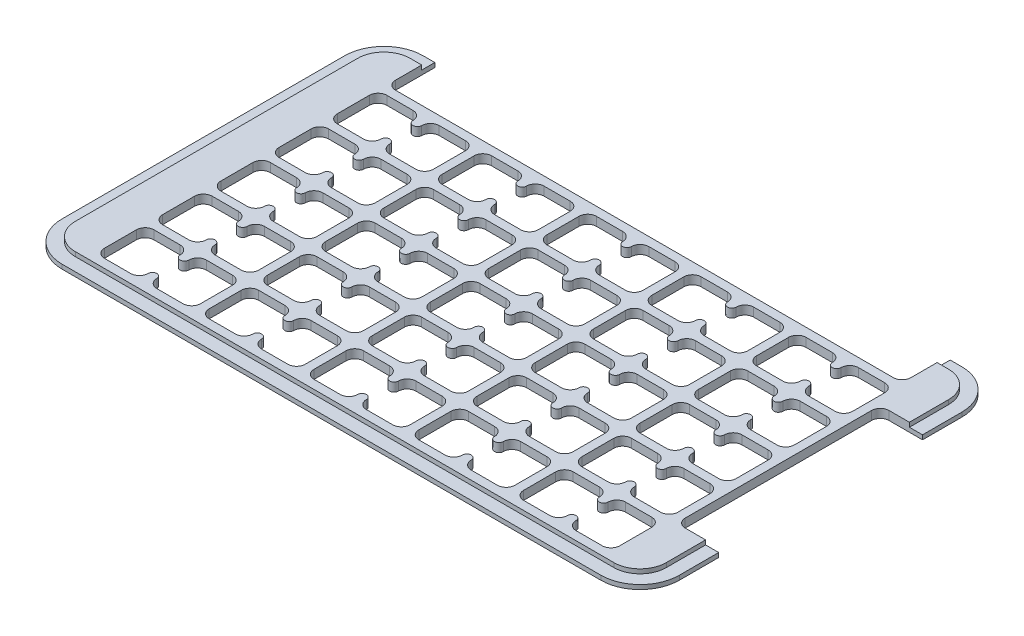
from build123d import *

# Parameters (mm, degrees)
SKETCH1_W                    = 212
SKETCH1_H                    = 124
OUTER_PROFILE_DEPTH          = 1.5
SKETCH2_W                    = 203
SKETCH2_H                    = 115
INNER_PROFILE_DEPTH          = 1.5
FILLET1_R                    = 9
FILLET2_R                    = 13.5
SKETCH4_W                    = 177
SKETCH4_H                    = 16.5
SKETCH4_W_2                  = 14.5
SKETCH4_H_2                  = 70
MESSAGE_BAR_DEPTH            = 123.837290755
CUTOUT_DEPTH                 = 123.837290755
CUTOUTS_COUNT                = 5
CUTOUTS_PITCH                = 18
CUTOUTS_COUNT_DIR2           = 5
CUTOUTS_PITCH_DIR2           = 20
MIRROR_CUTOUTS_COPY_1_DEPTH  = 123.837290755
MIRROR_CUTOUTS_COPY_2_DEPTH  = 123.837290755
MIRROR_CUTOUTS_COPY_3_DEPTH  = 123.837290755
MIRROR_CUTOUTS_COPY_4_DEPTH  = 123.837290755
MIRROR_CUTOUTS_COPY_5_DEPTH  = 123.837290755
MIRROR_CUTOUTS_COPY_6_DEPTH  = 123.837290755
MIRROR_CUTOUTS_COPY_7_DEPTH  = 123.837290755
MIRROR_CUTOUTS_COPY_8_DEPTH  = 123.837290755
MIRROR_CUTOUTS_COPY_9_DEPTH  = 123.837290755
MIRROR_CUTOUTS_COPY_10_DEPTH = 123.837290755
MIRROR_CUTOUTS_COPY_11_DEPTH = 123.837290755
MIRROR_CUTOUTS_COPY_12_DEPTH = 123.837290755
MIRROR_CUTOUTS_COPY_13_DEPTH = 123.837290755
MIRROR_CUTOUTS_COPY_14_DEPTH = 123.837290755
MIRROR_CUTOUTS_COPY_15_DEPTH = 123.837290755
MIRROR_CUTOUTS_COPY_16_DEPTH = 123.837290755
MIRROR_CUTOUTS_COPY_17_DEPTH = 123.837290755
MIRROR_CUTOUTS_COPY_18_DEPTH = 123.837290755
MIRROR_CUTOUTS_COPY_19_DEPTH = 123.837290755
MIRROR_CUTOUTS_COPY_20_DEPTH = 123.837290755
MIRROR_CUTOUTS_COPY_21_DEPTH = 123.837290755
MIRROR_CUTOUTS_COPY_22_DEPTH = 123.837290755
MIRROR_CUTOUTS_COPY_23_DEPTH = 123.837290755
MIRROR_CUTOUTS_COPY_24_DEPTH = 123.837290755
MIRROR_CUTOUTS_COPY_25_DEPTH = 123.837290755
CORNER_RAD_R                 = 3
OPENING_DEPTH                = 123.837290755
OPENINGS_COUNT               = 5
OPENINGS_PITCH               = 36
OPENINGS_COUNT_DIR2          = 5
OPENINGS_PITCH_DIR2          = 20


with BuildPart() as part:
    # Sketch1 → Outer Profile (new body)
    with BuildSketch(Plane(origin=(0, 0, 0), x_dir=(1, 0, 0), z_dir=(0, 1, 0))):
        Rectangle(SKETCH1_W, SKETCH1_H)
    extrude(amount=OUTER_PROFILE_DEPTH)

    # Sketch2 → Inner Profile (add)
    with BuildSketch(Plane(origin=(0, 1.5, 0), x_dir=(1, 0, 0), z_dir=(0, 1, 0))):
        Rectangle(SKETCH2_W, SKETCH2_H)
    extrude(amount=INNER_PROFILE_DEPTH)

    # Fillet1
    fillet1_edges = [part.edges().sort_by_distance(p)[0] for p in [
        (101.5, 2.25, 57.5),
        (101.5, 2.25, -57.5),
        (-101.5, 2.25, -57.5),
        (-101.5, 2.25, 57.5),
    ]]
    fillet(fillet1_edges, radius=FILLET1_R)

    # Fillet2
    fillet2_edges = [part.edges().sort_by_distance(p)[0] for p in [
        (-106, 0.75, -62),
        (106, 0.75, -62),
        (106, 0.75, 62),
        (-106, 0.75, 62),
    ]]
    fillet(fillet2_edges, radius=FILLET2_R)

    # Sketch4 → Message Bar (cut, through all)
    with BuildSketch(Plane(origin=(0, 3, 0), x_dir=(1, 0, 0), z_dir=(0, 1, 0))):
        with Locations((0, 53.75)):
            Rectangle(SKETCH4_W, SKETCH4_H)
        with Locations((98.75, 0)):
            Rectangle(SKETCH4_W_2, SKETCH4_H_2)
    extrude(amount=-MESSAGE_BAR_DEPTH, mode=Mode.SUBTRACT)

    # Sketch5 → Cutout (cut, through all)
    with BuildSketch(Plane(origin=(0, 3, 0), x_dir=(1, 0, 0), z_dir=(0, 1, 0))):
        with BuildLine():
            Line((-13.5, -54.5), (-4.5, -54.5))
            ThreePointArc((-4.5, -54.5), (-2.378679656, -53.621320344), (-1.5, -51.5))
            Line((-1.5, -51.5), (-1.5, -40.5))
            ThreePointArc((-1.5, -40.5), (-2.378679656, -38.378679656), (-4.5, -37.5))
            Line((-4.5, -37.5), (-13.5, -37.5))
            ThreePointArc((-13.5, -37.5), (-15.621320344, -38.378679656), (-16.5, -40.5))
            Line((-16.5, -40.5), (-16.5, -51.5))
            ThreePointArc((-16.5, -51.5), (-15.621320344, -53.621320344), (-13.5, -54.5))
        make_face()
    cutout = extrude(amount=-CUTOUT_DEPTH, mode=Mode.SUBTRACT)

    # Cutouts: Cutout 5 × 5
    with Locations(*[(-i * CUTOUTS_PITCH, 0, -j * CUTOUTS_PITCH_DIR2) for i in range(CUTOUTS_COUNT) for j in range(CUTOUTS_COUNT_DIR2) if (i, j) != (0, 0)]):
        add(cutout, mode=Mode.SUBTRACT)

    # Mirror Cutouts copy 1 sketch → Mirror Cutouts copy 1 (cut, through all)
    with BuildSketch(Plane(origin=(0, 3, -20), x_dir=(-1, 0, 0), z_dir=(0, 1, 0))):
        with BuildLine():
            Line((-13.5, 54.5), (-4.5, 54.5))
            ThreePointArc((-4.5, 54.5), (-2.378679656, 53.621320344), (-1.5, 51.5))
            Line((-1.5, 51.5), (-1.5, 40.5))
            ThreePointArc((-1.5, 40.5), (-2.378679656, 38.378679656), (-4.5, 37.5))
            Line((-4.5, 37.5), (-13.5, 37.5))
            ThreePointArc((-13.5, 37.5), (-15.621320344, 38.378679656), (-16.5, 40.5))
            Line((-16.5, 40.5), (-16.5, 51.5))
            ThreePointArc((-16.5, 51.5), (-15.621320344, 53.621320344), (-13.5, 54.5))
        make_face()
    extrude(amount=-MIRROR_CUTOUTS_COPY_1_DEPTH, mode=Mode.SUBTRACT)

    # Mirror Cutouts copy 2 sketch → Mirror Cutouts copy 2 (cut, through all)
    with BuildSketch(Plane(origin=(0, 3, -40), x_dir=(-1, 0, 0), z_dir=(0, 1, 0))):
        with BuildLine():
            Line((-13.5, 54.5), (-4.5, 54.5))
            ThreePointArc((-4.5, 54.5), (-2.378679656, 53.621320344), (-1.5, 51.5))
            Line((-1.5, 51.5), (-1.5, 40.5))
            ThreePointArc((-1.5, 40.5), (-2.378679656, 38.378679656), (-4.5, 37.5))
            Line((-4.5, 37.5), (-13.5, 37.5))
            ThreePointArc((-13.5, 37.5), (-15.621320344, 38.378679656), (-16.5, 40.5))
            Line((-16.5, 40.5), (-16.5, 51.5))
            ThreePointArc((-16.5, 51.5), (-15.621320344, 53.621320344), (-13.5, 54.5))
        make_face()
    extrude(amount=-MIRROR_CUTOUTS_COPY_2_DEPTH, mode=Mode.SUBTRACT)

    # Mirror Cutouts copy 3 sketch → Mirror Cutouts copy 3 (cut, through all)
    with BuildSketch(Plane(origin=(0, 3, -60), x_dir=(-1, 0, 0), z_dir=(0, 1, 0))):
        with BuildLine():
            Line((-13.5, 54.5), (-4.5, 54.5))
            ThreePointArc((-4.5, 54.5), (-2.378679656, 53.621320344), (-1.5, 51.5))
            Line((-1.5, 51.5), (-1.5, 40.5))
            ThreePointArc((-1.5, 40.5), (-2.378679656, 38.378679656), (-4.5, 37.5))
            Line((-4.5, 37.5), (-13.5, 37.5))
            ThreePointArc((-13.5, 37.5), (-15.621320344, 38.378679656), (-16.5, 40.5))
            Line((-16.5, 40.5), (-16.5, 51.5))
            ThreePointArc((-16.5, 51.5), (-15.621320344, 53.621320344), (-13.5, 54.5))
        make_face()
    extrude(amount=-MIRROR_CUTOUTS_COPY_3_DEPTH, mode=Mode.SUBTRACT)

    # Mirror Cutouts copy 4 sketch → Mirror Cutouts copy 4 (cut, through all)
    with BuildSketch(Plane(origin=(0, 3, -80), x_dir=(-1, 0, 0), z_dir=(0, 1, 0))):
        with BuildLine():
            Line((-13.5, 54.5), (-4.5, 54.5))
            ThreePointArc((-4.5, 54.5), (-2.378679656, 53.621320344), (-1.5, 51.5))
            Line((-1.5, 51.5), (-1.5, 40.5))
            ThreePointArc((-1.5, 40.5), (-2.378679656, 38.378679656), (-4.5, 37.5))
            Line((-4.5, 37.5), (-13.5, 37.5))
            ThreePointArc((-13.5, 37.5), (-15.621320344, 38.378679656), (-16.5, 40.5))
            Line((-16.5, 40.5), (-16.5, 51.5))
            ThreePointArc((-16.5, 51.5), (-15.621320344, 53.621320344), (-13.5, 54.5))
        make_face()
    extrude(amount=-MIRROR_CUTOUTS_COPY_4_DEPTH, mode=Mode.SUBTRACT)

    # Mirror Cutouts copy 5 sketch → Mirror Cutouts copy 5 (cut, through all)
    with BuildSketch(Plane(origin=(18, 3, 0), x_dir=(-1, 0, 0), z_dir=(0, 1, 0))):
        with BuildLine():
            Line((-13.5, 54.5), (-4.5, 54.5))
            ThreePointArc((-4.5, 54.5), (-2.378679656, 53.621320344), (-1.5, 51.5))
            Line((-1.5, 51.5), (-1.5, 40.5))
            ThreePointArc((-1.5, 40.5), (-2.378679656, 38.378679656), (-4.5, 37.5))
            Line((-4.5, 37.5), (-13.5, 37.5))
            ThreePointArc((-13.5, 37.5), (-15.621320344, 38.378679656), (-16.5, 40.5))
            Line((-16.5, 40.5), (-16.5, 51.5))
            ThreePointArc((-16.5, 51.5), (-15.621320344, 53.621320344), (-13.5, 54.5))
        make_face()
    extrude(amount=-MIRROR_CUTOUTS_COPY_5_DEPTH, mode=Mode.SUBTRACT)

    # Mirror Cutouts copy 6 sketch → Mirror Cutouts copy 6 (cut, through all)
    with BuildSketch(Plane(origin=(18, 3, -20), x_dir=(-1, 0, 0), z_dir=(0, 1, 0))):
        with BuildLine():
            Line((-13.5, 54.5), (-4.5, 54.5))
            ThreePointArc((-4.5, 54.5), (-2.378679656, 53.621320344), (-1.5, 51.5))
            Line((-1.5, 51.5), (-1.5, 40.5))
            ThreePointArc((-1.5, 40.5), (-2.378679656, 38.378679656), (-4.5, 37.5))
            Line((-4.5, 37.5), (-13.5, 37.5))
            ThreePointArc((-13.5, 37.5), (-15.621320344, 38.378679656), (-16.5, 40.5))
            Line((-16.5, 40.5), (-16.5, 51.5))
            ThreePointArc((-16.5, 51.5), (-15.621320344, 53.621320344), (-13.5, 54.5))
        make_face()
    extrude(amount=-MIRROR_CUTOUTS_COPY_6_DEPTH, mode=Mode.SUBTRACT)

    # Mirror Cutouts copy 7 sketch → Mirror Cutouts copy 7 (cut, through all)
    with BuildSketch(Plane(origin=(18, 3, -40), x_dir=(-1, 0, 0), z_dir=(0, 1, 0))):
        with BuildLine():
            Line((-13.5, 54.5), (-4.5, 54.5))
            ThreePointArc((-4.5, 54.5), (-2.378679656, 53.621320344), (-1.5, 51.5))
            Line((-1.5, 51.5), (-1.5, 40.5))
            ThreePointArc((-1.5, 40.5), (-2.378679656, 38.378679656), (-4.5, 37.5))
            Line((-4.5, 37.5), (-13.5, 37.5))
            ThreePointArc((-13.5, 37.5), (-15.621320344, 38.378679656), (-16.5, 40.5))
            Line((-16.5, 40.5), (-16.5, 51.5))
            ThreePointArc((-16.5, 51.5), (-15.621320344, 53.621320344), (-13.5, 54.5))
        make_face()
    extrude(amount=-MIRROR_CUTOUTS_COPY_7_DEPTH, mode=Mode.SUBTRACT)

    # Mirror Cutouts copy 8 sketch → Mirror Cutouts copy 8 (cut, through all)
    with BuildSketch(Plane(origin=(18, 3, -60), x_dir=(-1, 0, 0), z_dir=(0, 1, 0))):
        with BuildLine():
            Line((-13.5, 54.5), (-4.5, 54.5))
            ThreePointArc((-4.5, 54.5), (-2.378679656, 53.621320344), (-1.5, 51.5))
            Line((-1.5, 51.5), (-1.5, 40.5))
            ThreePointArc((-1.5, 40.5), (-2.378679656, 38.378679656), (-4.5, 37.5))
            Line((-4.5, 37.5), (-13.5, 37.5))
            ThreePointArc((-13.5, 37.5), (-15.621320344, 38.378679656), (-16.5, 40.5))
            Line((-16.5, 40.5), (-16.5, 51.5))
            ThreePointArc((-16.5, 51.5), (-15.621320344, 53.621320344), (-13.5, 54.5))
        make_face()
    extrude(amount=-MIRROR_CUTOUTS_COPY_8_DEPTH, mode=Mode.SUBTRACT)

    # Mirror Cutouts copy 9 sketch → Mirror Cutouts copy 9 (cut, through all)
    with BuildSketch(Plane(origin=(18, 3, -80), x_dir=(-1, 0, 0), z_dir=(0, 1, 0))):
        with BuildLine():
            Line((-13.5, 54.5), (-4.5, 54.5))
            ThreePointArc((-4.5, 54.5), (-2.378679656, 53.621320344), (-1.5, 51.5))
            Line((-1.5, 51.5), (-1.5, 40.5))
            ThreePointArc((-1.5, 40.5), (-2.378679656, 38.378679656), (-4.5, 37.5))
            Line((-4.5, 37.5), (-13.5, 37.5))
            ThreePointArc((-13.5, 37.5), (-15.621320344, 38.378679656), (-16.5, 40.5))
            Line((-16.5, 40.5), (-16.5, 51.5))
            ThreePointArc((-16.5, 51.5), (-15.621320344, 53.621320344), (-13.5, 54.5))
        make_face()
    extrude(amount=-MIRROR_CUTOUTS_COPY_9_DEPTH, mode=Mode.SUBTRACT)

    # Mirror Cutouts copy 10 sketch → Mirror Cutouts copy 10 (cut, through all)
    with BuildSketch(Plane(origin=(36, 3, 0), x_dir=(-1, 0, 0), z_dir=(0, 1, 0))):
        with BuildLine():
            Line((-13.5, 54.5), (-4.5, 54.5))
            ThreePointArc((-4.5, 54.5), (-2.378679656, 53.621320344), (-1.5, 51.5))
            Line((-1.5, 51.5), (-1.5, 40.5))
            ThreePointArc((-1.5, 40.5), (-2.378679656, 38.378679656), (-4.5, 37.5))
            Line((-4.5, 37.5), (-13.5, 37.5))
            ThreePointArc((-13.5, 37.5), (-15.621320344, 38.378679656), (-16.5, 40.5))
            Line((-16.5, 40.5), (-16.5, 51.5))
            ThreePointArc((-16.5, 51.5), (-15.621320344, 53.621320344), (-13.5, 54.5))
        make_face()
    extrude(amount=-MIRROR_CUTOUTS_COPY_10_DEPTH, mode=Mode.SUBTRACT)

    # Mirror Cutouts copy 11 sketch → Mirror Cutouts copy 11 (cut, through all)
    with BuildSketch(Plane(origin=(36, 3, -20), x_dir=(-1, 0, 0), z_dir=(0, 1, 0))):
        with BuildLine():
            Line((-13.5, 54.5), (-4.5, 54.5))
            ThreePointArc((-4.5, 54.5), (-2.378679656, 53.621320344), (-1.5, 51.5))
            Line((-1.5, 51.5), (-1.5, 40.5))
            ThreePointArc((-1.5, 40.5), (-2.378679656, 38.378679656), (-4.5, 37.5))
            Line((-4.5, 37.5), (-13.5, 37.5))
            ThreePointArc((-13.5, 37.5), (-15.621320344, 38.378679656), (-16.5, 40.5))
            Line((-16.5, 40.5), (-16.5, 51.5))
            ThreePointArc((-16.5, 51.5), (-15.621320344, 53.621320344), (-13.5, 54.5))
        make_face()
    extrude(amount=-MIRROR_CUTOUTS_COPY_11_DEPTH, mode=Mode.SUBTRACT)

    # Mirror Cutouts copy 12 sketch → Mirror Cutouts copy 12 (cut, through all)
    with BuildSketch(Plane(origin=(36, 3, -40), x_dir=(-1, 0, 0), z_dir=(0, 1, 0))):
        with BuildLine():
            Line((-13.5, 54.5), (-4.5, 54.5))
            ThreePointArc((-4.5, 54.5), (-2.378679656, 53.621320344), (-1.5, 51.5))
            Line((-1.5, 51.5), (-1.5, 40.5))
            ThreePointArc((-1.5, 40.5), (-2.378679656, 38.378679656), (-4.5, 37.5))
            Line((-4.5, 37.5), (-13.5, 37.5))
            ThreePointArc((-13.5, 37.5), (-15.621320344, 38.378679656), (-16.5, 40.5))
            Line((-16.5, 40.5), (-16.5, 51.5))
            ThreePointArc((-16.5, 51.5), (-15.621320344, 53.621320344), (-13.5, 54.5))
        make_face()
    extrude(amount=-MIRROR_CUTOUTS_COPY_12_DEPTH, mode=Mode.SUBTRACT)

    # Mirror Cutouts copy 13 sketch → Mirror Cutouts copy 13 (cut, through all)
    with BuildSketch(Plane(origin=(36, 3, -60), x_dir=(-1, 0, 0), z_dir=(0, 1, 0))):
        with BuildLine():
            Line((-13.5, 54.5), (-4.5, 54.5))
            ThreePointArc((-4.5, 54.5), (-2.378679656, 53.621320344), (-1.5, 51.5))
            Line((-1.5, 51.5), (-1.5, 40.5))
            ThreePointArc((-1.5, 40.5), (-2.378679656, 38.378679656), (-4.5, 37.5))
            Line((-4.5, 37.5), (-13.5, 37.5))
            ThreePointArc((-13.5, 37.5), (-15.621320344, 38.378679656), (-16.5, 40.5))
            Line((-16.5, 40.5), (-16.5, 51.5))
            ThreePointArc((-16.5, 51.5), (-15.621320344, 53.621320344), (-13.5, 54.5))
        make_face()
    extrude(amount=-MIRROR_CUTOUTS_COPY_13_DEPTH, mode=Mode.SUBTRACT)

    # Mirror Cutouts copy 14 sketch → Mirror Cutouts copy 14 (cut, through all)
    with BuildSketch(Plane(origin=(36, 3, -80), x_dir=(-1, 0, 0), z_dir=(0, 1, 0))):
        with BuildLine():
            Line((-13.5, 54.5), (-4.5, 54.5))
            ThreePointArc((-4.5, 54.5), (-2.378679656, 53.621320344), (-1.5, 51.5))
            Line((-1.5, 51.5), (-1.5, 40.5))
            ThreePointArc((-1.5, 40.5), (-2.378679656, 38.378679656), (-4.5, 37.5))
            Line((-4.5, 37.5), (-13.5, 37.5))
            ThreePointArc((-13.5, 37.5), (-15.621320344, 38.378679656), (-16.5, 40.5))
            Line((-16.5, 40.5), (-16.5, 51.5))
            ThreePointArc((-16.5, 51.5), (-15.621320344, 53.621320344), (-13.5, 54.5))
        make_face()
    extrude(amount=-MIRROR_CUTOUTS_COPY_14_DEPTH, mode=Mode.SUBTRACT)

    # Mirror Cutouts copy 15 sketch → Mirror Cutouts copy 15 (cut, through all)
    with BuildSketch(Plane(origin=(54, 3, 0), x_dir=(-1, 0, 0), z_dir=(0, 1, 0))):
        with BuildLine():
            Line((-13.5, 54.5), (-4.5, 54.5))
            ThreePointArc((-4.5, 54.5), (-2.378679656, 53.621320344), (-1.5, 51.5))
            Line((-1.5, 51.5), (-1.5, 40.5))
            ThreePointArc((-1.5, 40.5), (-2.378679656, 38.378679656), (-4.5, 37.5))
            Line((-4.5, 37.5), (-13.5, 37.5))
            ThreePointArc((-13.5, 37.5), (-15.621320344, 38.378679656), (-16.5, 40.5))
            Line((-16.5, 40.5), (-16.5, 51.5))
            ThreePointArc((-16.5, 51.5), (-15.621320344, 53.621320344), (-13.5, 54.5))
        make_face()
    extrude(amount=-MIRROR_CUTOUTS_COPY_15_DEPTH, mode=Mode.SUBTRACT)

    # Mirror Cutouts copy 16 sketch → Mirror Cutouts copy 16 (cut, through all)
    with BuildSketch(Plane(origin=(54, 3, -20), x_dir=(-1, 0, 0), z_dir=(0, 1, 0))):
        with BuildLine():
            Line((-13.5, 54.5), (-4.5, 54.5))
            ThreePointArc((-4.5, 54.5), (-2.378679656, 53.621320344), (-1.5, 51.5))
            Line((-1.5, 51.5), (-1.5, 40.5))
            ThreePointArc((-1.5, 40.5), (-2.378679656, 38.378679656), (-4.5, 37.5))
            Line((-4.5, 37.5), (-13.5, 37.5))
            ThreePointArc((-13.5, 37.5), (-15.621320344, 38.378679656), (-16.5, 40.5))
            Line((-16.5, 40.5), (-16.5, 51.5))
            ThreePointArc((-16.5, 51.5), (-15.621320344, 53.621320344), (-13.5, 54.5))
        make_face()
    extrude(amount=-MIRROR_CUTOUTS_COPY_16_DEPTH, mode=Mode.SUBTRACT)

    # Mirror Cutouts copy 17 sketch → Mirror Cutouts copy 17 (cut, through all)
    with BuildSketch(Plane(origin=(54, 3, -40), x_dir=(-1, 0, 0), z_dir=(0, 1, 0))):
        with BuildLine():
            Line((-13.5, 54.5), (-4.5, 54.5))
            ThreePointArc((-4.5, 54.5), (-2.378679656, 53.621320344), (-1.5, 51.5))
            Line((-1.5, 51.5), (-1.5, 40.5))
            ThreePointArc((-1.5, 40.5), (-2.378679656, 38.378679656), (-4.5, 37.5))
            Line((-4.5, 37.5), (-13.5, 37.5))
            ThreePointArc((-13.5, 37.5), (-15.621320344, 38.378679656), (-16.5, 40.5))
            Line((-16.5, 40.5), (-16.5, 51.5))
            ThreePointArc((-16.5, 51.5), (-15.621320344, 53.621320344), (-13.5, 54.5))
        make_face()
    extrude(amount=-MIRROR_CUTOUTS_COPY_17_DEPTH, mode=Mode.SUBTRACT)

    # Mirror Cutouts copy 18 sketch → Mirror Cutouts copy 18 (cut, through all)
    with BuildSketch(Plane(origin=(54, 3, -60), x_dir=(-1, 0, 0), z_dir=(0, 1, 0))):
        with BuildLine():
            Line((-13.5, 54.5), (-4.5, 54.5))
            ThreePointArc((-4.5, 54.5), (-2.378679656, 53.621320344), (-1.5, 51.5))
            Line((-1.5, 51.5), (-1.5, 40.5))
            ThreePointArc((-1.5, 40.5), (-2.378679656, 38.378679656), (-4.5, 37.5))
            Line((-4.5, 37.5), (-13.5, 37.5))
            ThreePointArc((-13.5, 37.5), (-15.621320344, 38.378679656), (-16.5, 40.5))
            Line((-16.5, 40.5), (-16.5, 51.5))
            ThreePointArc((-16.5, 51.5), (-15.621320344, 53.621320344), (-13.5, 54.5))
        make_face()
    extrude(amount=-MIRROR_CUTOUTS_COPY_18_DEPTH, mode=Mode.SUBTRACT)

    # Mirror Cutouts copy 19 sketch → Mirror Cutouts copy 19 (cut, through all)
    with BuildSketch(Plane(origin=(54, 3, -80), x_dir=(-1, 0, 0), z_dir=(0, 1, 0))):
        with BuildLine():
            Line((-13.5, 54.5), (-4.5, 54.5))
            ThreePointArc((-4.5, 54.5), (-2.378679656, 53.621320344), (-1.5, 51.5))
            Line((-1.5, 51.5), (-1.5, 40.5))
            ThreePointArc((-1.5, 40.5), (-2.378679656, 38.378679656), (-4.5, 37.5))
            Line((-4.5, 37.5), (-13.5, 37.5))
            ThreePointArc((-13.5, 37.5), (-15.621320344, 38.378679656), (-16.5, 40.5))
            Line((-16.5, 40.5), (-16.5, 51.5))
            ThreePointArc((-16.5, 51.5), (-15.621320344, 53.621320344), (-13.5, 54.5))
        make_face()
    extrude(amount=-MIRROR_CUTOUTS_COPY_19_DEPTH, mode=Mode.SUBTRACT)

    # Mirror Cutouts copy 20 sketch → Mirror Cutouts copy 20 (cut, through all)
    with BuildSketch(Plane(origin=(72, 3, 0), x_dir=(-1, 0, 0), z_dir=(0, 1, 0))):
        with BuildLine():
            Line((-13.5, 54.5), (-4.5, 54.5))
            ThreePointArc((-4.5, 54.5), (-2.378679656, 53.621320344), (-1.5, 51.5))
            Line((-1.5, 51.5), (-1.5, 40.5))
            ThreePointArc((-1.5, 40.5), (-2.378679656, 38.378679656), (-4.5, 37.5))
            Line((-4.5, 37.5), (-13.5, 37.5))
            ThreePointArc((-13.5, 37.5), (-15.621320344, 38.378679656), (-16.5, 40.5))
            Line((-16.5, 40.5), (-16.5, 51.5))
            ThreePointArc((-16.5, 51.5), (-15.621320344, 53.621320344), (-13.5, 54.5))
        make_face()
    extrude(amount=-MIRROR_CUTOUTS_COPY_20_DEPTH, mode=Mode.SUBTRACT)

    # Mirror Cutouts copy 21 sketch → Mirror Cutouts copy 21 (cut, through all)
    with BuildSketch(Plane(origin=(72, 3, -20), x_dir=(-1, 0, 0), z_dir=(0, 1, 0))):
        with BuildLine():
            Line((-13.5, 54.5), (-4.5, 54.5))
            ThreePointArc((-4.5, 54.5), (-2.378679656, 53.621320344), (-1.5, 51.5))
            Line((-1.5, 51.5), (-1.5, 40.5))
            ThreePointArc((-1.5, 40.5), (-2.378679656, 38.378679656), (-4.5, 37.5))
            Line((-4.5, 37.5), (-13.5, 37.5))
            ThreePointArc((-13.5, 37.5), (-15.621320344, 38.378679656), (-16.5, 40.5))
            Line((-16.5, 40.5), (-16.5, 51.5))
            ThreePointArc((-16.5, 51.5), (-15.621320344, 53.621320344), (-13.5, 54.5))
        make_face()
    extrude(amount=-MIRROR_CUTOUTS_COPY_21_DEPTH, mode=Mode.SUBTRACT)

    # Mirror Cutouts copy 22 sketch → Mirror Cutouts copy 22 (cut, through all)
    with BuildSketch(Plane(origin=(72, 3, -40), x_dir=(-1, 0, 0), z_dir=(0, 1, 0))):
        with BuildLine():
            Line((-13.5, 54.5), (-4.5, 54.5))
            ThreePointArc((-4.5, 54.5), (-2.378679656, 53.621320344), (-1.5, 51.5))
            Line((-1.5, 51.5), (-1.5, 40.5))
            ThreePointArc((-1.5, 40.5), (-2.378679656, 38.378679656), (-4.5, 37.5))
            Line((-4.5, 37.5), (-13.5, 37.5))
            ThreePointArc((-13.5, 37.5), (-15.621320344, 38.378679656), (-16.5, 40.5))
            Line((-16.5, 40.5), (-16.5, 51.5))
            ThreePointArc((-16.5, 51.5), (-15.621320344, 53.621320344), (-13.5, 54.5))
        make_face()
    extrude(amount=-MIRROR_CUTOUTS_COPY_22_DEPTH, mode=Mode.SUBTRACT)

    # Mirror Cutouts copy 23 sketch → Mirror Cutouts copy 23 (cut, through all)
    with BuildSketch(Plane(origin=(72, 3, -60), x_dir=(-1, 0, 0), z_dir=(0, 1, 0))):
        with BuildLine():
            Line((-13.5, 54.5), (-4.5, 54.5))
            ThreePointArc((-4.5, 54.5), (-2.378679656, 53.621320344), (-1.5, 51.5))
            Line((-1.5, 51.5), (-1.5, 40.5))
            ThreePointArc((-1.5, 40.5), (-2.378679656, 38.378679656), (-4.5, 37.5))
            Line((-4.5, 37.5), (-13.5, 37.5))
            ThreePointArc((-13.5, 37.5), (-15.621320344, 38.378679656), (-16.5, 40.5))
            Line((-16.5, 40.5), (-16.5, 51.5))
            ThreePointArc((-16.5, 51.5), (-15.621320344, 53.621320344), (-13.5, 54.5))
        make_face()
    extrude(amount=-MIRROR_CUTOUTS_COPY_23_DEPTH, mode=Mode.SUBTRACT)

    # Mirror Cutouts copy 24 sketch → Mirror Cutouts copy 24 (cut, through all)
    with BuildSketch(Plane(origin=(72, 3, -80), x_dir=(-1, 0, 0), z_dir=(0, 1, 0))):
        with BuildLine():
            Line((-13.5, 54.5), (-4.5, 54.5))
            ThreePointArc((-4.5, 54.5), (-2.378679656, 53.621320344), (-1.5, 51.5))
            Line((-1.5, 51.5), (-1.5, 40.5))
            ThreePointArc((-1.5, 40.5), (-2.378679656, 38.378679656), (-4.5, 37.5))
            Line((-4.5, 37.5), (-13.5, 37.5))
            ThreePointArc((-13.5, 37.5), (-15.621320344, 38.378679656), (-16.5, 40.5))
            Line((-16.5, 40.5), (-16.5, 51.5))
            ThreePointArc((-16.5, 51.5), (-15.621320344, 53.621320344), (-13.5, 54.5))
        make_face()
    extrude(amount=-MIRROR_CUTOUTS_COPY_24_DEPTH, mode=Mode.SUBTRACT)

    # Mirror Cutouts copy 25 sketch → Mirror Cutouts copy 25 (cut, through all)
    with BuildSketch(Plane(origin=(0, 3, 0), x_dir=(-1, 0, 0), z_dir=(0, 1, 0))):
        with BuildLine():
            Line((-13.5, 54.5), (-4.5, 54.5))
            ThreePointArc((-4.5, 54.5), (-2.378679656, 53.621320344), (-1.5, 51.5))
            Line((-1.5, 51.5), (-1.5, 40.5))
            ThreePointArc((-1.5, 40.5), (-2.378679656, 38.378679656), (-4.5, 37.5))
            Line((-4.5, 37.5), (-13.5, 37.5))
            ThreePointArc((-13.5, 37.5), (-15.621320344, 38.378679656), (-16.5, 40.5))
            Line((-16.5, 40.5), (-16.5, 51.5))
            ThreePointArc((-16.5, 51.5), (-15.621320344, 53.621320344), (-13.5, 54.5))
        make_face()
    extrude(amount=-MIRROR_CUTOUTS_COPY_25_DEPTH, mode=Mode.SUBTRACT)

    # Corner Rad
    corner_rad_edges = [part.edges().sort_by_distance(p)[0] for p in [
        (88.5, 1.5, -45.5),
        (-88.5, 1.5, -45.5),
        (91.5, 1.5, 35),
        (91.5, 1.5, -35),
    ]]
    fillet(corner_rad_edges, radius=CORNER_RAD_R)

    # Sketch6 → Opening (cut, through all)
    with BuildSketch(Plane(origin=(0, 3, 0), x_dir=(1, 0, 0), z_dir=(0, 1, 0))):
        with BuildLine():
            Line((-73.5, 39.5), (-73.5, 28.5))
            ThreePointArc((-73.5, 28.5), (-72, 30), (-70.5, 28.5))
            Line((-70.5, 28.5), (-70.5, 39.5))
            ThreePointArc((-70.5, 39.5), (-72, 38), (-73.5, 39.5))
        make_face()
    opening = extrude(amount=-OPENING_DEPTH, mode=Mode.SUBTRACT)

    # Openings: Opening 5 × 5
    with Locations(*[(i * OPENINGS_PITCH, 0, j * OPENINGS_PITCH_DIR2) for i in range(OPENINGS_COUNT) for j in range(OPENINGS_COUNT_DIR2) if (i, j) != (0, 0)]):
        add(opening, mode=Mode.SUBTRACT)


solid = part.part
